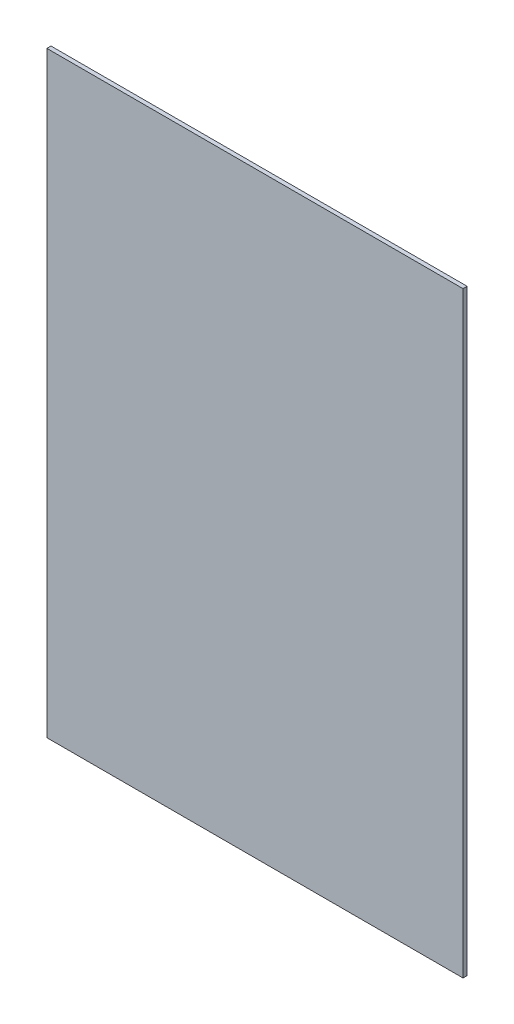
from build123d import *

# Parameters (mm, degrees)
SKETCH_2_W      = 608.3
SKETCH_2_H      = 872.6
EXTRUDE_1_DEPTH = 6


with BuildPart() as part:
    # Эскиз2 → Бобышка-Вытянуть1 (new body)
    with BuildSketch(Plane.XY):
        with Locations((834.15, 0)):
            Rectangle(SKETCH_2_W, SKETCH_2_H)
    extrude(amount=-EXTRUDE_1_DEPTH)


solid = part.part
